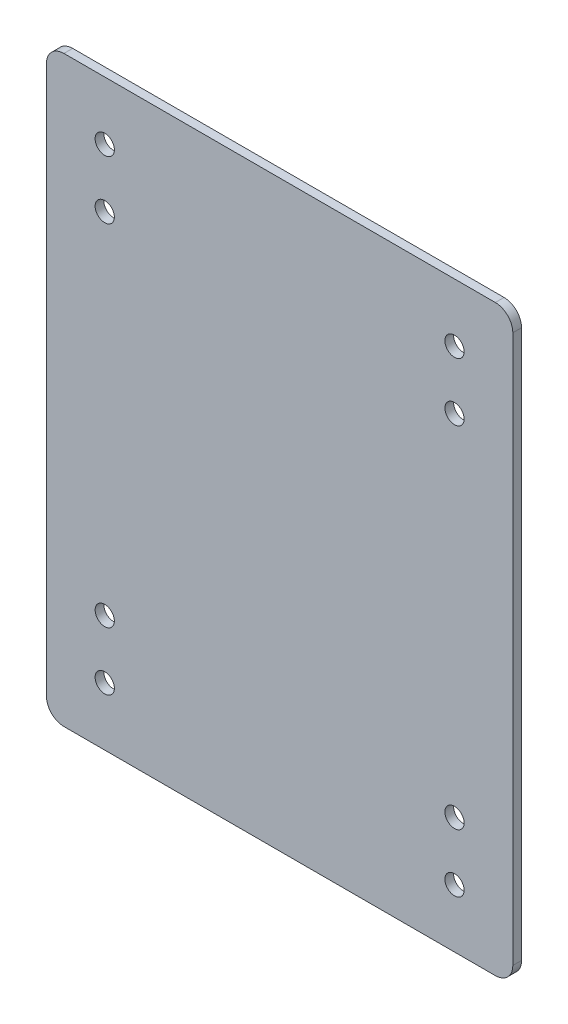
from build123d import *

# Parameters (mm, degrees)
CONVERT_SOLID1_START     = -1.5
CONVERT_SOLID1_OUTLINE_R = 1.65
CONVERT_SOLID1_DEPTH     = 1.5


# Read off the part's stored shape, not the designer's step: Convert-Solid1
with BuildPart() as part:
    # Convert-Solid1 outline → Convert-Solid1 (new body)
    with BuildSketch(Plane.XY.offset(CONVERT_SOLID1_START)):
        with BuildLine():
            Line((80, 3), (80, 97))
            ThreePointArc((80, 97), (79.121320344, 99.121320344), (77, 100))
            Line((77, 100), (3, 100))
            ThreePointArc((3, 100), (0.878679656, 99.121320344), (0, 97))
            Line((0, 97), (0, 3))
            ThreePointArc((0, 3), (0.878679656, 0.878679656), (3, 0))
            Line((3, 0), (77, 0))
            ThreePointArc((77, 0), (79.121320344, 0.878679656), (80, 3))
        make_face()
        with Locations((10, 10)):
            Circle(CONVERT_SOLID1_OUTLINE_R, mode=Mode.SUBTRACT)
        with Locations((10, 20)):
            Circle(CONVERT_SOLID1_OUTLINE_R, mode=Mode.SUBTRACT)
        with Locations((70, 10)):
            Circle(CONVERT_SOLID1_OUTLINE_R, mode=Mode.SUBTRACT)
        with Locations((70, 20)):
            Circle(CONVERT_SOLID1_OUTLINE_R, mode=Mode.SUBTRACT)
        with Locations((10, 80)):
            Circle(CONVERT_SOLID1_OUTLINE_R, mode=Mode.SUBTRACT)
        with Locations((10, 90)):
            Circle(CONVERT_SOLID1_OUTLINE_R, mode=Mode.SUBTRACT)
        with Locations((70, 80)):
            Circle(CONVERT_SOLID1_OUTLINE_R, mode=Mode.SUBTRACT)
        with Locations((70, 90)):
            Circle(CONVERT_SOLID1_OUTLINE_R, mode=Mode.SUBTRACT)
    extrude(amount=CONVERT_SOLID1_DEPTH)


solid = part.part
